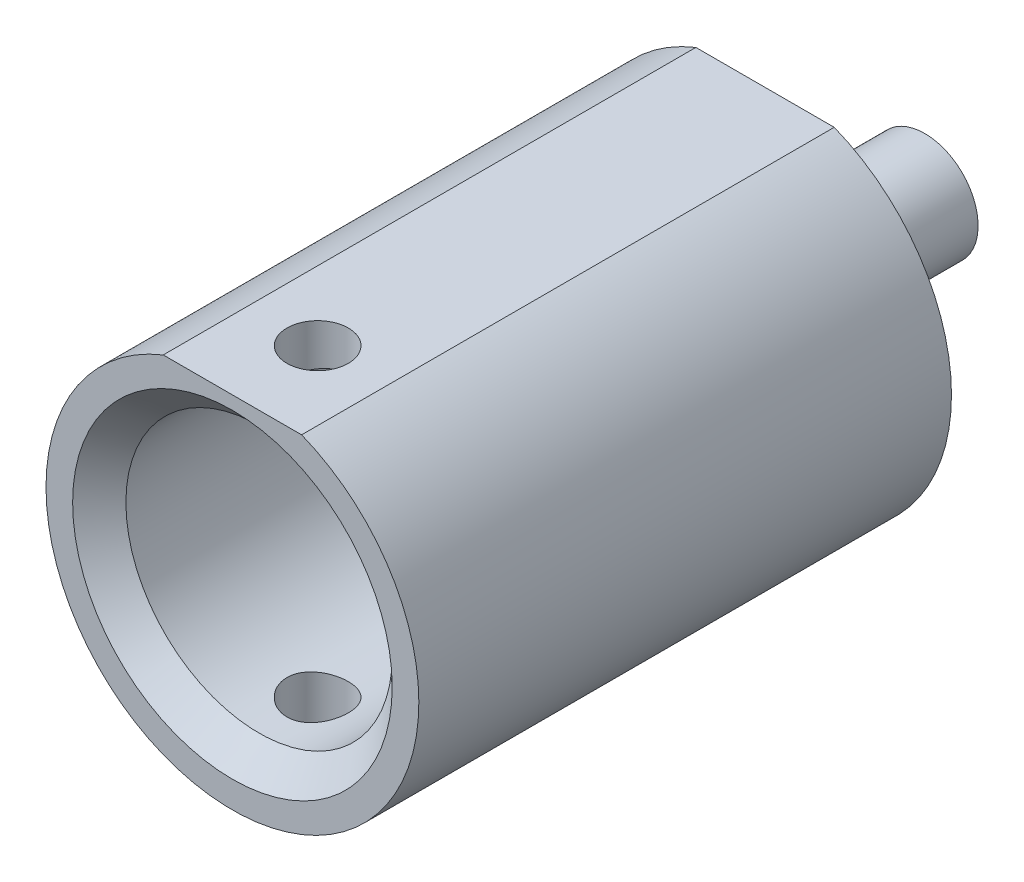
from build123d import *

# Parameters (mm, degrees)
F_5_8_0_625_DIAMETER_HOLE1_D     = 15.875
F_5_8_0_625_DIAMETER_HOLE1_DEPTH = 25.4
F_5_8_0_625_DIAMETER_HOLE1_TIP   = 4.769331164
CUT_EXTRUDE1_DEPTH               = 45.165608085
CUT_EXTRUDE1_DEPTH_BACK          = 45.165608085
SKETCH3_W                        = 31.75
SKETCH3_H                        = 0.79375
F_6_CLEARANCE_HOLE1_D            = 3.6576
CHAMFER1_SIZE                    = 1.5875


with BuildPart() as part:
    # Sketch1 → Revolve1 (revolve)
    with BuildSketch(Plane(origin=(0, 0, 0), x_dir=(1, 0, 0), z_dir=(0, 1, 0))):
        Polygon((0, 0), (7.9375, 0), (11.1125, 0), (11.1125, 31.75), (3.175, 31.75), (3.175, 41.275), (0, 41.275), (0, 25.4), align=None)
    revolve(axis=Axis((0, 0, -25.4), (0, 0, 1)))

    # 5/8 (0.625) Diameter Hole1
    with Locations(Plane.XY):
        with Locations((0, 0)):
            Hole(F_5_8_0_625_DIAMETER_HOLE1_D / 2, depth=F_5_8_0_625_DIAMETER_HOLE1_DEPTH)
            with Locations((0, 0, -(F_5_8_0_625_DIAMETER_HOLE1_DEPTH + F_5_8_0_625_DIAMETER_HOLE1_TIP / 2))):  # 118° drill point
                Cone(0, F_5_8_0_625_DIAMETER_HOLE1_D / 2, F_5_8_0_625_DIAMETER_HOLE1_TIP, mode=Mode.SUBTRACT)

    # Sketch3 → Cut-Extrude1 (cut, two sides: drawn at the far end of the back side and taken through both)
    with BuildSketch(Plane(origin=(0, 0, 0), x_dir=(0, 0, -1), z_dir=(1, 0, 0)).offset(-CUT_EXTRUDE1_DEPTH_BACK)):
        with Locations((15.875, 10.715625)):
            Rectangle(SKETCH3_W, SKETCH3_H)
    extrude(amount=CUT_EXTRUDE1_DEPTH + CUT_EXTRUDE1_DEPTH_BACK, mode=Mode.SUBTRACT)

    # #6 Clearance Hole1 (through all)
    with Locations(Plane(origin=(0, 10.31875, 0), x_dir=(1, 0, 0), z_dir=(0, 1, 0))):
        with Locations((0, 5.08)):
            Hole(F_6_CLEARANCE_HOLE1_D / 2)

    # Chamfer1
    chamfer1_edges = [part.edges().sort_by_distance(p)[0] for p in [
        (7.9375, 0, 0),
    ]]
    chamfer(chamfer1_edges, length=CHAMFER1_SIZE)


solid = part.part
